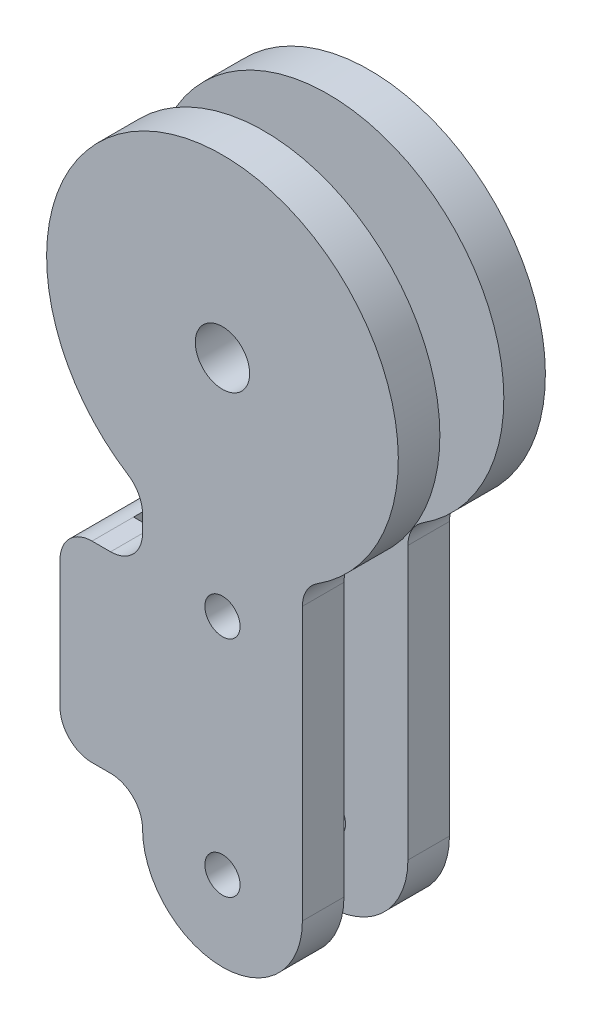
from build123d import *

# Parameters (mm, degrees)
SKETCH2_R           = 4.25
SKETCH2_R_2         = 2.75
BOSS_EXTRUDE1_DEPTH = 6.5
SKETCH3_W           = 20
SKETCH3_H           = 30
BOSS_EXTRUDE2_DEPTH = 6.5
SKETCH4_R           = 2.75
CUT_EXTRUDE1_DEPTH  = 289.885357884
SKETCH5_W           = 0.4
SKETCH5_H           = 30
BOSS_EXTRUDE3_DEPTH = 6.5
SKETCH6_R           = 2.75
SKETCH6_R_2         = 4
BOSS_EXTRUDE4_DEPTH = 6.5
SKETCH9_W           = 23
SKETCH9_H           = 30
BOSS_EXTRUDE6_DEPTH = 5
BOSS_EXTRUDE7_DEPTH = 14
FILLET1_START       = -17
FILLET1_DEPTH       = 24
FILLET1_START_2     = -16.5
FILLET1_2_DEPTH     = 6.5
FILLET1_3_DEPTH     = 6.5


with BuildPart() as part:
    # Sketch2 → Boss-Extrude1 (new body)
    with BuildSketch(Plane.XY):
        with BuildLine():
            ThreePointArc((12.5, 235.505102572), (0, 287.5), (-12.5, 235.505102572))
            Line((-12.5, 235.505102572), (-12.5, 190))
            ThreePointArc((-12.5, 190), (0, 177.5), (12.5, 190))
            Line((12.5, 190), (12.5, 235.505102572))
        make_face()
        with Locations(Location((0, 260, 0), (0, 0, 180))):
            Circle(SKETCH2_R, mode=Mode.SUBTRACT)
        with Locations(Location((0, 225, 0), (0, 0, 180))):
            Circle(SKETCH2_R_2, mode=Mode.SUBTRACT)
        with Locations(Location((0, 190, 0), (0, 0, 180))):
            Circle(SKETCH2_R_2, mode=Mode.SUBTRACT)
    extrude(amount=BOSS_EXTRUDE1_DEPTH)

    # Sketch3 → Boss-Extrude2 (add)
    with BuildSketch(Plane.XY.offset(6.5)):
        with Locations((-10, 210)):
            Rectangle(SKETCH3_W, SKETCH3_H)
    extrude(amount=-BOSS_EXTRUDE2_DEPTH)

    # Sketch4 → Cut-Extrude1 (cut, through all)
    with BuildSketch(Plane.XY.offset(6.5)):
        with Locations(Location((0, 225, 0), (0, 0, 180))):
            Circle(SKETCH4_R)
    extrude(amount=-CUT_EXTRUDE1_DEPTH, mode=Mode.SUBTRACT)

    # Sketch5 → Boss-Extrude3 (add)
    with BuildSketch(Plane.XY.offset(6.5)):
        with Locations((-20.2, 210)):
            Rectangle(SKETCH5_W, SKETCH5_H)
    extrude(amount=-BOSS_EXTRUDE3_DEPTH)



with BuildPart() as body_2:
    # Sketch6 → Boss-Extrude4 (new body)
    with BuildSketch(Plane(origin=(0, 0, -10), x_dir=(-1, 0, 0), z_dir=(0, 0, -1))):
        with BuildLine():
            Line((12.5, 190), (12.5, 195))
            Line((12.5, 195), (20.4, 195))
            Line((20.4, 195), (20.4, 225))
            Line((20.4, 225), (12.5, 225))
            Line((12.5, 225), (12.5, 235.505102572))
            ThreePointArc((12.5, 235.505102572), (0, 287.5), (-12.5, 235.505102572))
            Line((-12.5, 235.505102572), (-12.5, 190))
            ThreePointArc((-12.5, 190), (0, 177.5), (12.5, 190))
        make_face()
        with Locations((0, 190)):
            Circle(SKETCH6_R, mode=Mode.SUBTRACT)
        with Locations((0, 225)):
            Circle(SKETCH6_R, mode=Mode.SUBTRACT)
        with Locations(Location((0, 260, 0), (0, 0, 180))):
            Circle(SKETCH6_R_2, mode=Mode.SUBTRACT)
    extrude(amount=BOSS_EXTRUDE4_DEPTH)


with BuildPart() as part_1:
    add(part.part)

    add(body_2.part)  # Boss-Extrude6 merges body 2
    # Sketch9 → Boss-Extrude6 (add)
    with BuildSketch(Plane.ZY.offset(20.4)):
        with Locations((-5, 210)):
            Rectangle(SKETCH9_W, SKETCH9_H)
    extrude(amount=BOSS_EXTRUDE6_DEPTH)

    # Sketch10 → Boss-Extrude7 (add)
    with BuildSketch(Plane(origin=(0, 0, 0), x_dir=(-1, 0, 0), z_dir=(0, 0, -1))):
        with BuildLine():
            ThreePointArc((20.4, 241.558470779), (25.406687144, 249.47620561), (27.465108704, 258.615152031))
            Line((27.465108704, 258.615152031), (23.211774901, 254.361818228))
            ThreePointArc((23.211774901, 254.361818228), (21.130756488, 251.24735408), (20.4, 247.573593129))
            Line((20.4, 247.573593129), (20.4, 241.558470779))
        make_face()
    extrude(amount=BOSS_EXTRUDE7_DEPTH)

    # Fillet1: read off the stored shape, not the designer's step
    # Fillet1 outline → Fillet1 (cut)
    with BuildSketch(Plane.XY.offset(FILLET1_START)):
        with BuildLine():
            ThreePointArc((-20.4, 195), (-23.935533906, 196.464466094), (-25.4, 200))
            Line((-25.4, 200), (-25.4, 195))
            Line((-25.4, 195), (-20.4, 195))
        make_face()
        with BuildLine():
            ThreePointArc((-25.4, 220), (-23.935533906, 223.535533906), (-20.4, 225))
            Line((-20.4, 225), (-25.4, 225))
            Line((-25.4, 225), (-25.4, 220))
        make_face()
    extrude(amount=FILLET1_DEPTH, mode=Mode.SUBTRACT)

    # Fillet1 2 outline → Fillet1 2 (add)
    with BuildSketch(Plane.XY.offset(FILLET1_START_2)):
        with BuildLine():
            Line((12.5, 235.505102572), (12.5, 232.613872125))
            ThreePointArc((12.5, 232.613872125), (13.114709903, 235.015794432), (14.807692308, 236.827122567))
            ThreePointArc((14.807692308, 236.827122567), (13.669837198, 236.138198916), (12.5, 235.505102572))
        make_face()
        with BuildLine():
            Line((-12.5, 195), (-17.5, 195))
            ThreePointArc((-17.5, 195), (-13.964466094, 193.535533906), (-12.5, 190))
            Line((-12.5, 190), (-12.5, 195))
        make_face()
        with BuildLine():
            Line((-12.5, 225), (-12.5, 230))
            ThreePointArc((-12.5, 230), (-13.964466094, 226.464466094), (-17.5, 225))
            Line((-17.5, 225), (-12.5, 225))
        make_face()
        with BuildLine():
            ThreePointArc((-12.5, 235.505102572), (-13.669837198, 236.138198916), (-14.807692308, 236.827122567))
            ThreePointArc((-14.807692308, 236.827122567), (-13.114709903, 235.015794432), (-12.5, 232.613872125))
            Line((-12.5, 232.613872125), (-12.5, 235.505102572))
        make_face()
    extrude(amount=FILLET1_2_DEPTH)

    # Fillet1 3 outline → Fillet1 3 (add)
    with BuildSketch(Plane.XY):
        with BuildLine():
            Line((12.5, 235.505102572), (12.5, 232.613872125))
            ThreePointArc((12.5, 232.613872125), (13.114709903, 235.015794432), (14.807692308, 236.827122567))
            ThreePointArc((14.807692308, 236.827122567), (13.669837198, 236.138198916), (12.5, 235.505102572))
        make_face()
        with BuildLine():
            Line((-12.5, 195), (-17.5, 195))
            ThreePointArc((-17.5, 195), (-13.964466094, 193.535533906), (-12.5, 190))
            Line((-12.5, 190), (-12.5, 195))
        make_face()
        with BuildLine():
            Line((-12.5, 225), (-12.5, 230))
            ThreePointArc((-12.5, 230), (-13.964466094, 226.464466094), (-17.5, 225))
            Line((-17.5, 225), (-12.5, 225))
        make_face()
        with BuildLine():
            ThreePointArc((-12.5, 235.505102572), (-13.669837198, 236.138198916), (-14.807692308, 236.827122567))
            ThreePointArc((-14.807692308, 236.827122567), (-13.114709903, 235.015794432), (-12.5, 232.613872125))
            Line((-12.5, 232.613872125), (-12.5, 235.505102572))
        make_face()
    extrude(amount=FILLET1_3_DEPTH)


solid = part_1.part
